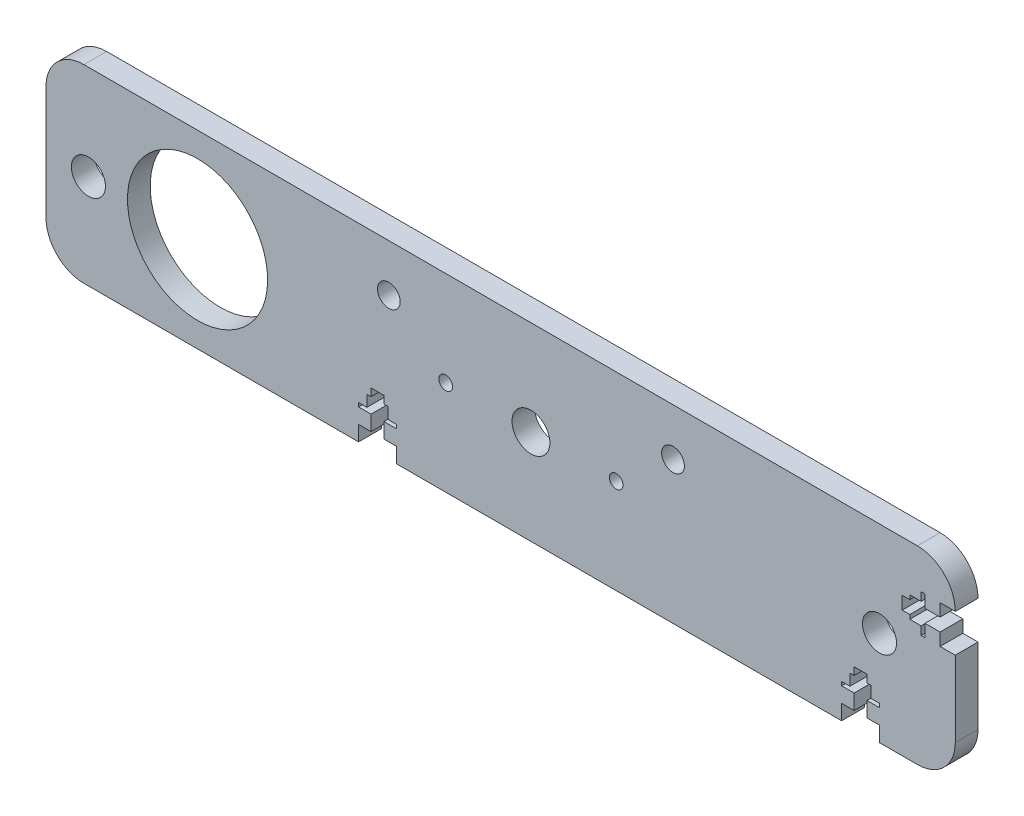
from build123d import *

# Parameters (mm, degrees)
ESBO_O1_R                = 4.5
ESBO_O1_R_2              = 18.5
ESBO_O1_R_3              = 1.8
ESBO_O1_R_4              = 5
ESBO_O1_R_5              = 3
RESSALTO_EXTRUS_O1_DEPTH = 6


with BuildPart() as part:
    # Esboço1 → Ressalto-extrusão1 (new body)
    with BuildSketch(Plane.XY):
        with BuildLine():
            Line((100, -21), (100, -25))
            Line((100, -25), (110, -25))
            ThreePointArc((110, -25), (117.071067812, -22.071067812), (120, -15))
            Line((120, -15), (120, 5))
            Line((120, 5), (116, 5))
            Line((116, 5), (116, 8.3))
            Line((116, 8.3), (112, 8.3))
            Line((112, 8.3), (112, 5))
            Line((112, 5), (111, 5))
            Line((111, 5), (111, 7.2))
            Line((111, 7.2), (108, 7.2))
            Line((108, 7.2), (108, 8.3))
            Line((108, 8.3), (106, 8.3))
            Line((106, 8.3), (106, 11.7))
            Line((106, 11.7), (108, 11.7))
            Line((108, 11.7), (108, 12.8))
            Line((108, 12.8), (111, 12.8))
            Line((111, 12.8), (111, 15))
            Line((111, 15), (112, 15))
            Line((112, 15), (112, 11.7))
            Line((112, 11.7), (116, 11.7))
            Line((116, 11.7), (116, 15))
            Line((116, 15), (120, 15))
            ThreePointArc((120, 15), (117.071067812, 22.071067812), (110, 25))
            Line((110, 25), (-110, 25))
            ThreePointArc((-110, 25), (-117.071067812, 22.071067812), (-120, 15))
            Line((-120, 15), (-120, -15))
            ThreePointArc((-120, -15), (-117.071067812, -22.071067812), (-110, -25))
            Line((-110, -25), (-37.5, -25))
            Line((-37.5, -25), (-37.5, -21))
            Line((-37.5, -21), (-34.2, -21))
            Line((-34.2, -21), (-34.2, -17))
            Line((-34.2, -17), (-37.5, -17))
            Line((-37.5, -17), (-37.5, -16))
            Line((-37.5, -16), (-35.3, -16))
            Line((-35.3, -16), (-35.3, -13))
            Line((-35.3, -13), (-34.2, -13))
            Line((-34.2, -13), (-34.2, -11))
            Line((-34.2, -11), (-30.8, -11))
            Line((-30.8, -11), (-30.8, -13))
            Line((-30.8, -13), (-29.7, -13))
            Line((-29.7, -13), (-29.7, -16))
            Line((-29.7, -16), (-27.5, -16))
            Line((-27.5, -16), (-27.5, -17))
            Line((-27.5, -17), (-30.8, -17))
            Line((-30.8, -17), (-30.8, -21))
            Line((-30.8, -21), (-27.5, -21))
            Line((-27.5, -21), (-27.5, -25))
            Line((-27.5, -25), (90, -25))
            Line((90, -25), (90, -21))
            Line((90, -21), (93.3, -21))
            Line((93.3, -21), (93.3, -17))
            Line((93.3, -17), (90, -17))
            Line((90, -17), (90, -16))
            Line((90, -16), (92.2, -16))
            Line((92.2, -16), (92.2, -13))
            Line((92.2, -13), (93.3, -13))
            Line((93.3, -13), (93.3, -11))
            Line((93.3, -11), (96.7, -11))
            Line((96.7, -11), (96.7, -13))
            Line((96.7, -13), (97.8, -13))
            Line((97.8, -13), (97.8, -16))
            Line((97.8, -16), (100, -16))
            Line((100, -16), (100, -17))
            Line((100, -17), (96.7, -17))
            Line((96.7, -17), (96.7, -21))
            Line((96.7, -21), (100, -21))
        make_face()
        with Locations((-108.81, 0)):
            Circle(ESBO_O1_R, mode=Mode.SUBTRACT)
        with Locations((-80, 0)):
            Circle(ESBO_O1_R_2, mode=Mode.SUBTRACT)
        with Locations((-14.5, 0)):
            Circle(ESBO_O1_R_3, mode=Mode.SUBTRACT)
        with Locations((8, 0)):
            Circle(ESBO_O1_R_4, mode=Mode.SUBTRACT)
        with Locations((100, 0)):
            Circle(ESBO_O1_R, mode=Mode.SUBTRACT)
        with Locations((-29.5, 12.5)):
            Circle(ESBO_O1_R_5, mode=Mode.SUBTRACT)
        with Locations((30.5, 0)):
            Circle(ESBO_O1_R_3, mode=Mode.SUBTRACT)
        with Locations((45.5, 12.5)):
            Circle(ESBO_O1_R_5, mode=Mode.SUBTRACT)
    extrude(amount=RESSALTO_EXTRUS_O1_DEPTH)


solid = part.part
